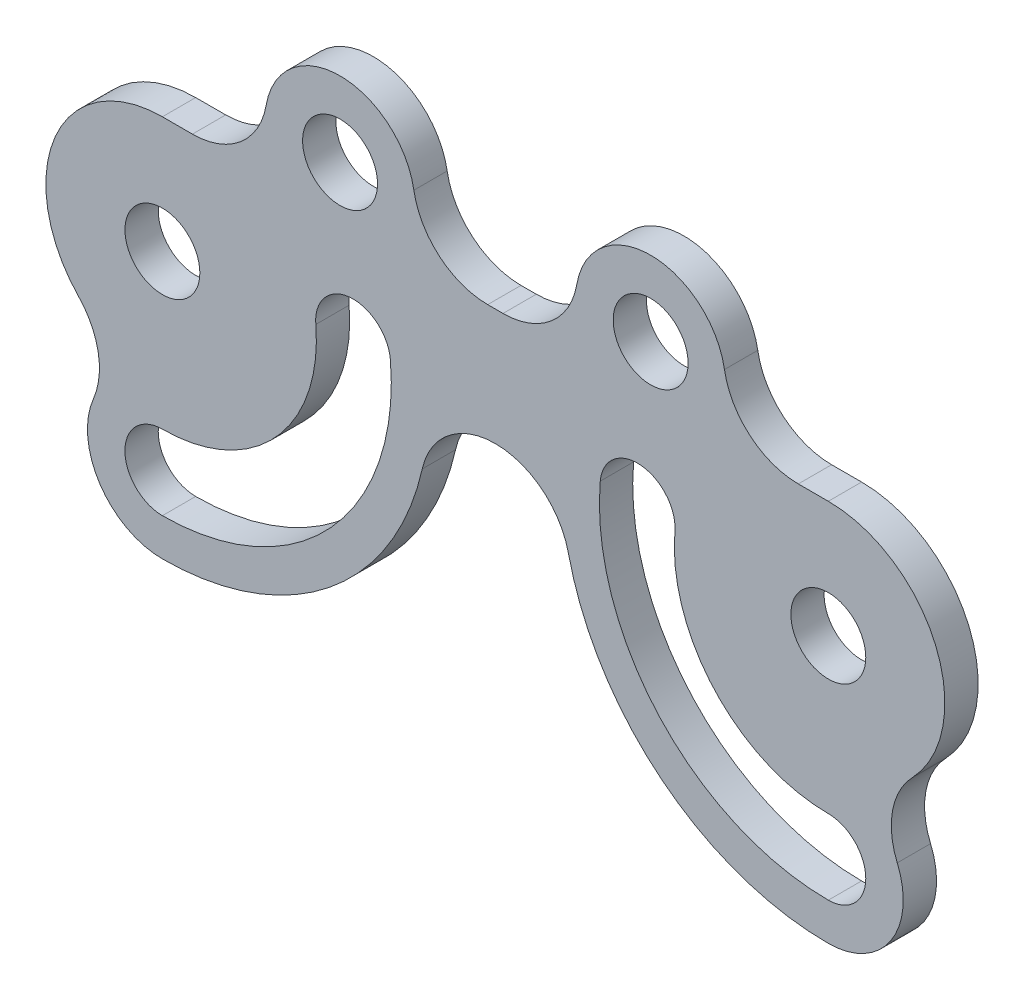
from build123d import *

# Parameters (mm, degrees)
SKETCH1_R           = 1.7859375
BOSS_EXTRUDE1_DEPTH = 1.5875
FILLET1_R           = 3.571875


with BuildPart() as part:
    # Sketch1 → Boss-Extrude1 (new body)
    with BuildSketch(Plane.XY):
        with BuildLine():
            ThreePointArc((31.75, -12.7), (35.321875, -9.128125), (31.75, -5.55625))
            ThreePointArc((31.75, -5.55625), (37.30625, 0), (31.75, 5.55625))
            Line((31.75, 5.55625), (25.964019559, 5.55625))
            ThreePointArc((25.964019559, 5.55625), (23.279229109, 11.484009389), (20.594438658, 5.55625))
            Line((20.594438658, 5.55625), (11.155561342, 5.55625))
            ThreePointArc((11.155561342, 5.55625), (8.470770891, 11.484009389), (5.785980441, 5.55625))
            Line((5.785980441, 5.55625), (0, 5.55625))
            ThreePointArc((0, 5.55625), (-5.55625, 0), (0, -5.55625))
            ThreePointArc((0, -5.55625), (-3.571875, -9.128125), (0, -12.7))
            ThreePointArc((0, -12.7), (8.980256121, -8.980256121), (12.7, 0))
            Line((12.7, 0), (19.05, 0))
            ThreePointArc((19.05, 0), (22.769743879, -8.980256121), (31.75, -12.7))
        make_face()
        with BuildLine():
            ThreePointArc((0, -10.9140625), (-1.7859375, -9.128125), (0, -7.3421875))
            ThreePointArc((0, -7.3421875), (5.413228446, -4.960309977), (7.31424826, 0.639913805))
            ThreePointArc((7.31424826, 0.639913805), (8.937735019, 2.574709983), (10.872531197, 0.951223224))
            ThreePointArc((10.872531197, 0.951223224), (8.046690934, -7.37343375), (0, -10.9140625))
        make_face(mode=Mode.SUBTRACT)
        with BuildLine():
            ThreePointArc((24.43575174, 0.639913805), (26.336771554, -4.960309977), (31.75, -7.3421875))
            ThreePointArc((31.75, -7.3421875), (33.5359375, -9.128125), (31.75, -10.9140625))
            ThreePointArc((31.75, -10.9140625), (23.703309066, -7.37343375), (20.877468803, 0.951223224))
            ThreePointArc((20.877468803, 0.951223224), (22.812264981, 2.574709983), (24.43575174, 0.639913805))
        make_face(mode=Mode.SUBTRACT)
        Circle(SKETCH1_R, mode=Mode.SUBTRACT)
        with Locations((8.470770891, 7.912134389)):
            Circle(SKETCH1_R, mode=Mode.SUBTRACT)
        with Locations((31.75, 0)):
            Circle(SKETCH1_R, mode=Mode.SUBTRACT)
        with Locations((23.279229109, 7.912134389)):
            Circle(SKETCH1_R, mode=Mode.SUBTRACT)
    extrude(amount=BOSS_EXTRUDE1_DEPTH)

    # Fillet1
    fillet1_edges = [part.edges().sort_by_distance(p)[0] for p in [
        (31.75, -5.55625, 0.79375),
        (19.05, 0, 0.79375),
        (12.7, 0, 0.79375),
        (0, -5.55625, 0.79375),
        (20.594438658, 5.55625, 0.79375),
        (25.964019559, 5.55625, 0.79375),
        (5.785980441, 5.55625, 0.79375),
        (11.155561342, 5.55625, 0.79375),
    ]]
    fillet(fillet1_edges, radius=FILLET1_R - 0.0001)  # a hair under: the kernel refuses the full size


solid = part.part
